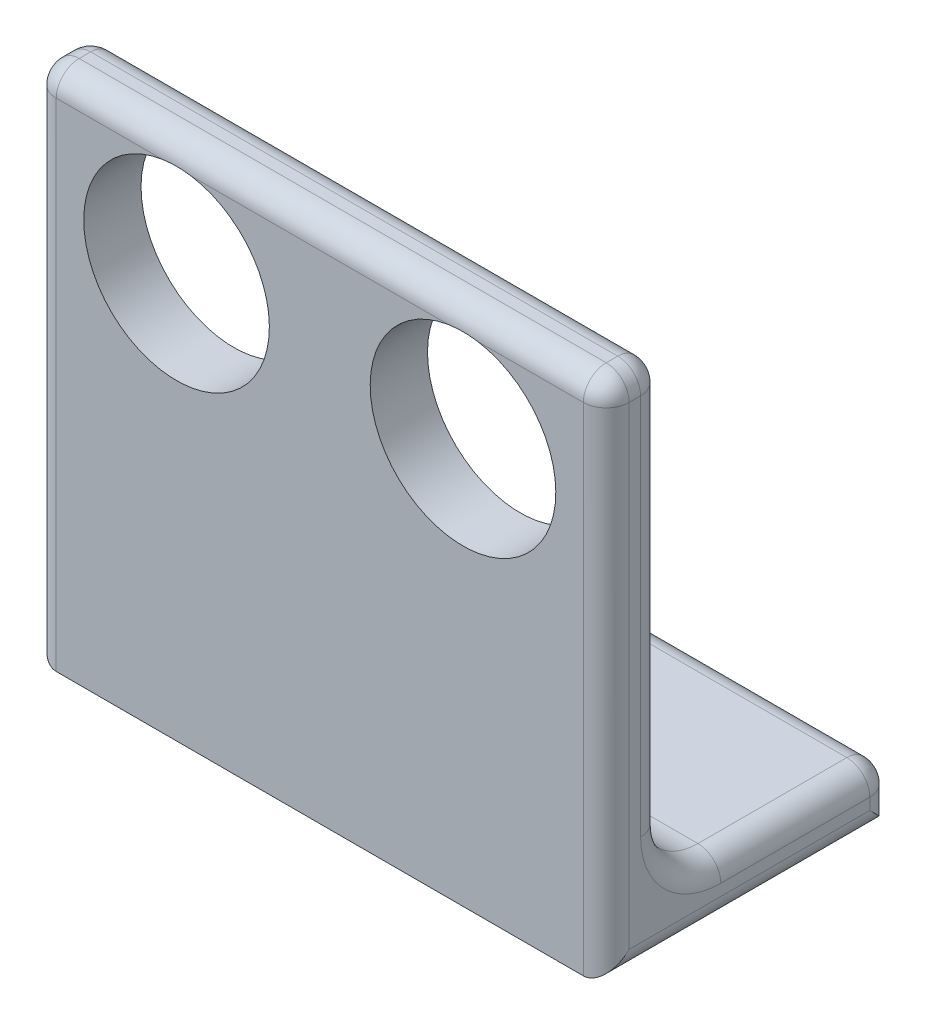
from build123d import *

# Parameters (mm, degrees)
SKETCH_2_W          = 50
SKETCH_2_H          = 25
EXTRUDE_4_DEPTH     = 5
SKETCH_7_W          = 50
SKETCH_7_H          = 5
EXTRUDE_5_DEPTH     = 40.339506062
FILLET_11_R         = 2
FILLET_12_R         = 2
FILLET_15_R         = 5
FILLET_17_R         = 2
FILLET_18_R         = 2
FILLET_19_R         = 2
SKETCH_8_R          = 8.1
CUT_EXTRUDE_4_DEPTH = 25


with BuildPart() as part:
    # 草图2 → 凸台-拉伸4 (new body)
    with BuildSketch(Plane(origin=(0, 0, 0), x_dir=(1, 0, 0), z_dir=(0, 1, 0))):
        with Locations((25, 12.5)):
            Rectangle(SKETCH_2_W, SKETCH_2_H)
    extrude(amount=EXTRUDE_4_DEPTH)

    # 草图7 → 凸台-拉伸5 (add)
    with BuildSketch(Plane(origin=(0, 5, 0), x_dir=(1, 0, 0), z_dir=(0, 1, 0))):
        with Locations((25, 2.5)):
            Rectangle(SKETCH_7_W, SKETCH_7_H)
    extrude(amount=EXTRUDE_5_DEPTH)

    # 圆角11
    fillet_11_edges = [part.edges().sort_by_distance(p)[0] for p in [
        (25, 45.339506062, 0),
    ]]
    fillet(fillet_11_edges, radius=FILLET_11_R)

    # 圆角12
    fillet_12_edges = [part.edges().sort_by_distance(p)[0] for p in [
        (25, 45.339506062, -5),
    ]]
    fillet(fillet_12_edges, radius=FILLET_12_R)

    # 圆角15
    fillet_15_edges = [part.edges().sort_by_distance(p)[0] for p in [
        (25, 5, -5),
    ]]
    fillet(fillet_15_edges, radius=FILLET_15_R)

    # 圆角17
    fillet_17_edges = [part.edges().sort_by_distance(p)[0] for p in [
        (50, 45.339506062, -2.5),
        (50, 21.669753031, 0),
        (50, 44.753719625, -0.585786438),
        (50, 26.669753031, -5),
        (50, 44.753719625, -4.414213562),
        (50, 5, -17.5),
        (50, 6.464466094, -6.464466094),
        (50, 0, -12.5),
        (50, 2.5, -25),
    ]]
    fillet(fillet_17_edges, radius=FILLET_17_R)

    # 圆角18
    # the kernel refuses this fillet: 2 mm, written as the material it takes off along each edge
    with BuildSketch(Plane(origin=(48, 3, -23), x_dir=(0, 0, -1), z_dir=(0, 1, 0))) as fillet_18_piece_1_section:
        Polygon((0, 0), (FILLET_18_R, 0), (FILLET_18_R, -FILLET_18_R), (0, -FILLET_18_R), align=None)
    fillet_18_piece_1 = extrude(amount=FILLET_18_R, mode=Mode.PRIVATE)
    fillet_18_piece_1 = fillet_18_piece_1 - Plane(origin=(48, 3, -23), x_dir=(-0.7071067811865475, 0, 0.7071067811865475), z_dir=(0, 1, 0)) * Sphere(FILLET_18_R, mode=Mode.PRIVATE)
    add(fillet_18_piece_1, mode=Mode.SUBTRACT)
    with BuildSketch(Plane(origin=(48, 5, -25), x_dir=(0, 0, 1), z_dir=(-1, 0, 0))) as fillet_18_piece_2:
        with BuildLine():
            CenterArc((FILLET_18_R, -FILLET_18_R), FILLET_18_R, 90, 90)
            Line((0, -FILLET_18_R), (0, 0))
            Line((0, 0), (FILLET_18_R, 0))
        make_face()
    extrude(amount=53, mode=Mode.SUBTRACT)

    # 圆角19
    fillet_19_edges = [part.edges().sort_by_distance(p)[0] for p in [
        (0, 21.669753031, 0),
        (0, 44.753719625, -0.585786438),
        (0, 45.339506062, -2.5),
        (0, 26.669753031, -5),
        (0, 44.753719625, -4.414213562),
        (0, 6.464466094, -6.464466094),
        (0, 0, -12.5),
        (0, 5, -16.5),
        (0, 1.5, -25),
        (0, 4.414213562, -24.414213562),
    ]]
    fillet(fillet_19_edges, radius=FILLET_19_R)

    # 草图8 → 切除-拉伸4 (cut)
    with BuildSketch(Plane(origin=(0, 0, -5), x_dir=(-1, 0, 0), z_dir=(0, 0, -1))):
        with Locations(Location((-37.5, 35.339506062, 0), (0, 0, 80.987548501))):
            Circle(SKETCH_8_R)
        with Locations(Location((-12.5, 35.339506062, 0), (0, 0, 80.987548501))):
            Circle(SKETCH_8_R)
    extrude(amount=-CUT_EXTRUDE_4_DEPTH, mode=Mode.SUBTRACT)


solid = part.part
